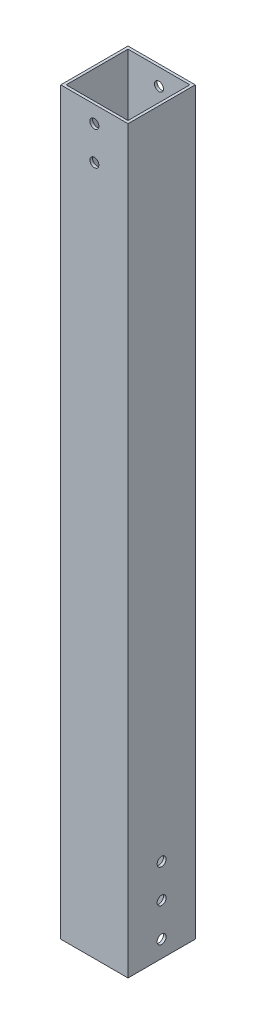
from build123d import *

# Parameters (mm, degrees)
SKETCH1_W              = 38.1
SKETCH1_H              = 38.1
SKETCH1_W_2            = 35.052
SKETCH1_H_2            = 35.052
EXTRUDE_THIN1_DEPTH    = 419.1
F_10_CLEARANCE_HOLE1_D = 5.1054
F_10_CLEARANCE_HOLE2_D = 5.1054


with BuildPart() as part:
    # Sketch1 → Extrude-Thin1 (new body)
    with BuildSketch(Plane(origin=(0, 0, 0), x_dir=(1, 0, 0), z_dir=(0, 1, 0))):
        Rectangle(SKETCH1_W, SKETCH1_H)
        Rectangle(SKETCH1_W_2, SKETCH1_H_2, mode=Mode.SUBTRACT)
    extrude(amount=EXTRUDE_THIN1_DEPTH)

    # #10 Clearance Hole1 (through all)
    with Locations(Plane(origin=(19.05, 0, 0), x_dir=(0, 0, -1), z_dir=(1, 0, 0))):
        with Locations((0, 9.525), (0, 28.575), (0, 47.625)):
            Hole(F_10_CLEARANCE_HOLE1_D / 2)

    # #10 Clearance Hole2 (through all)
    with Locations(Plane.XY.offset(19.05)):
        with Locations((0, 390.525), (0, 409.575)):
            Hole(F_10_CLEARANCE_HOLE2_D / 2)


solid = part.part
